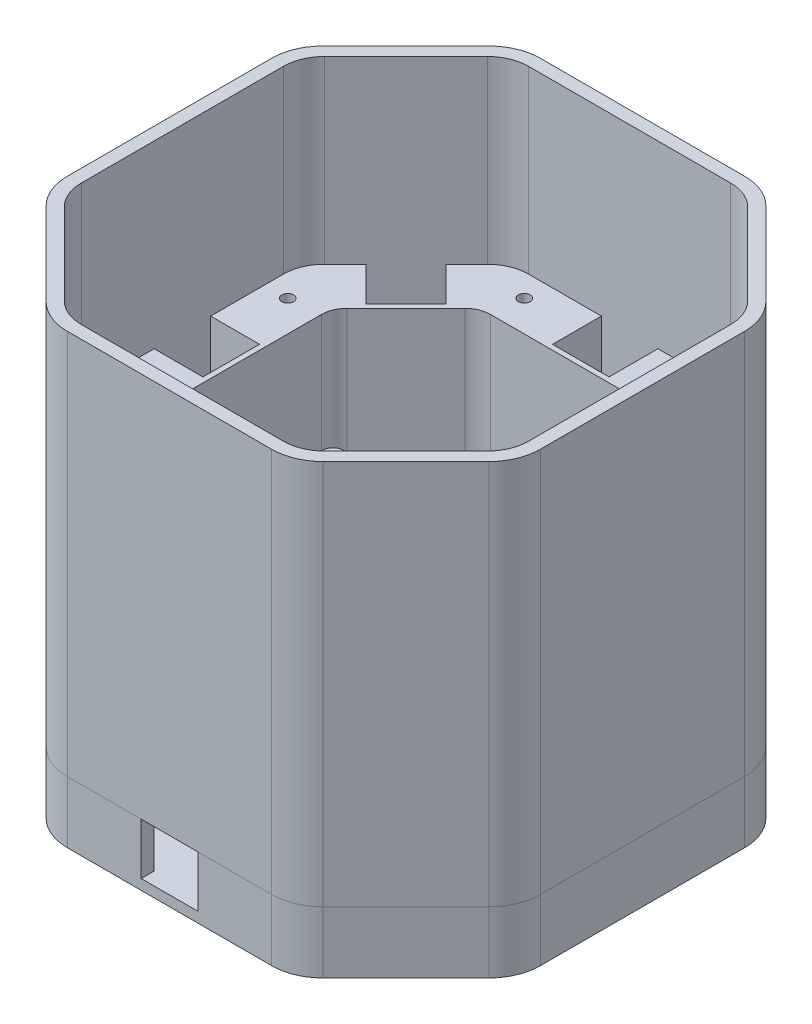
from build123d import *

# Parameters (mm, degrees)
EXTRUDE_1_DEPTH      = 35
SKETCH_2_W           = 14
SKETCH_2_H           = 10.5
EXTRUDE_2_DEPTH      = 30
EXTRUDE_2_2_DEPTH    = 30
SKETCH_2_W_2         = 10.5
SKETCH_2_H_2         = 14
EXTRUDE_2_3_DEPTH    = 30
EXTRUDE_2_4_DEPTH    = 30
EXTRUDE_2_5_DEPTH    = 30
EXTRUDE_2_6_DEPTH    = 30
EXTRUDE_2_7_DEPTH    = 30
EXTRUDE_2_8_DEPTH    = 30
EXTRUDE_3_DEPTH      = 40
EXTRUDE_4_DEPTH      = 10
SKETCH_7_W           = 20
SKETCH_7_H           = 11.5
EXTRUDE_5_DEPTH      = 30
SKETCH_8_W           = 11
SKETCH_8_H           = 9.5
SKETCH_8_W_2         = 9.5
SKETCH_8_H_2         = 11
CUT_EXTRUDE_1_DEPTH  = 77.367532368
CUT_EXTRUDE_2_DEPTH  = 8
FILLET_1_R           = 8
FILLET_2_R           = 10
EXTRUDE_START        = 30
EXTRUDE_7_DEPTH      = 30
FILLET_3_R           = 5
FILLET_4_R           = 5
FILLET_5_R           = 2
SKETCH_17_R          = 1.15
CUT_EXTRUDE_6_DEPTH  = 77.367532368
SKETCH_18_R          = 2
CUT_EXTRUDE_7_DEPTH  = 29
SKETCH_20_W          = 9.5
SKETCH_20_H          = 7
SKETCH_20_W_2        = 7
SKETCH_20_H_2        = 9.5
EXTRUDE_8_DEPTH      = 8
FILLET_6_R           = 3
SKETCH_21_R          = 1.65
CUT_EXTRUDE_8_DEPTH  = 10
EXTRUDE_9_DEPTH      = 12
CUT_EXTRUDE_10_DEPTH = 10
SKETCH_24_R          = 1.15
CUT_EXTRUDE_11_DEPTH = 109.632407688
SKETCH_25_R          = 2.05
CUT_EXTRUDE_12_DEPTH = 2
SKETCH_26_W          = 11
SKETCH_26_H          = 2.5
CUT_EXTRUDE_13_DEPTH = 10


# Read off the part's stored shape, not the designer's step: 凸台-拉伸1
with BuildPart() as part:
    # 凸台-拉伸1 outline → 凸台-拉伸1 (new body)
    with BuildSketch(Plane(origin=(0, 0, 0), x_dir=(1, 0, 0), z_dir=(0, 1, 0))):
        Polygon((24.003571337, -46), (46, -24.003571337), (46, 24.003571337), (24.003571337, 46), (-24.003571337, 46), (-46, 24.003571337), (-46, -24.003571337), (-24.003571337, -46), align=None)
        Polygon((43.5, 22.968037432), (43.5, -22.968037432), (22.968037432, -43.5), (-22.968037432, -43.5), (-43.5, -22.968037432), (-43.5, 22.968037432), (-22.968037432, 43.5), (22.968037432, 43.5), align=None, mode=Mode.SUBTRACT)
    extrude(amount=EXTRUDE_1_DEPTH)



with BuildPart() as body_2:
    # 草图2 → 凸台-拉伸2 (new body)
    with BuildSketch(Plane.XZ):
        with Locations((0, -38.25)):
            Rectangle(SKETCH_2_W, SKETCH_2_H)
    extrude(amount=EXTRUDE_2_DEPTH)


with BuildPart() as body_3:
    # 草图2 → Extrude 2 2 (new body)
    with BuildSketch(Plane.XZ):
        Polygon((20.859650045, -30.759144982), (28.284271247, -38.183766184), (38.183766184, -28.284271247), (30.759144982, -20.859650045), align=None)
    extrude(amount=EXTRUDE_2_2_DEPTH)


with BuildPart() as body_4:
    # 草图2 → Extrude 2 3 (new body)
    with BuildSketch(Plane.XZ):
        with Locations((-38.25, 0)):
            Rectangle(SKETCH_2_W_2, SKETCH_2_H_2)
    extrude(amount=EXTRUDE_2_3_DEPTH)


with BuildPart() as body_5:
    # 草图2 → Extrude 2 4 (new body)
    with BuildSketch(Plane.XZ):
        Polygon((-30.759144982, -20.859650045), (-20.859650045, -30.759144982), (-28.284271247, -38.183766184), (-38.183766184, -28.284271247), align=None)
    extrude(amount=EXTRUDE_2_4_DEPTH)


with BuildPart() as body_6:
    # 草图2 → Extrude 2 5 (new body)
    with BuildSketch(Plane.XZ):
        with Locations((0, 38.25)):
            Rectangle(SKETCH_2_W, SKETCH_2_H)
    extrude(amount=EXTRUDE_2_5_DEPTH)


with BuildPart() as body_7:
    # 草图2 → Extrude 2 6 (new body)
    with BuildSketch(Plane.XZ):
        Polygon((-20.859650045, 30.759144982), (-30.759144982, 20.859650045), (-38.183766184, 28.284271247), (-28.284271247, 38.183766184), align=None)
    extrude(amount=EXTRUDE_2_6_DEPTH)


with BuildPart() as body_8:
    # 草图2 → Extrude 2 7 (new body)
    with BuildSketch(Plane.XZ):
        with Locations((38.25, 0)):
            Rectangle(SKETCH_2_W_2, SKETCH_2_H_2)
    extrude(amount=EXTRUDE_2_7_DEPTH)


with BuildPart() as body_9:
    # 草图2 → Extrude 2 8 (new body)
    with BuildSketch(Plane.XZ):
        Polygon((30.759144982, 20.859650045), (20.859650045, 30.759144982), (28.284271247, 38.183766184), (38.183766184, 28.284271247), align=None)
    extrude(amount=EXTRUDE_2_8_DEPTH)


with BuildPart() as part_1:
    add(part.part)

    add(body_2.part)  # 凸台-拉伸3 merges body 2

    add(body_3.part)  # 凸台-拉伸3 merges body 3

    add(body_4.part)  # 凸台-拉伸3 merges body 4

    add(body_5.part)  # 凸台-拉伸3 merges body 5

    add(body_6.part)  # 凸台-拉伸3 merges body 6

    add(body_7.part)  # 凸台-拉伸3 merges body 7

    add(body_8.part)  # 凸台-拉伸3 merges body 8

    add(body_9.part)  # 凸台-拉伸3 merges body 9
    # 草图5 → 凸台-拉伸3 (add)
    with BuildSketch(Plane.XZ):
        Polygon((46, 24.003571337), (24.003571337, 46), (-24.003571337, 46), (-46, 24.003571337), (-46, -24.003571337), (-24.003571337, -46), (24.003571337, -46), (46, -24.003571337), align=None)
        Polygon((22.968037432, 43.5), (-22.968037432, 43.5), (-43.5, 22.968037432), (-43.5, -22.968037432), (-22.968037432, -43.5), (22.968037432, -43.5), (43.5, -22.968037432), (43.5, 22.968037432), align=None, mode=Mode.SUBTRACT)
    extrude(amount=EXTRUDE_3_DEPTH)

    # 草图6 → 凸台-拉伸4 (add)
    with BuildSketch(Plane.XZ.offset(30)):
        Polygon((46, -24.003571337), (46, 24.003571337), (24.003571337, 46), (-24.003571337, 46), (-46, 24.003571337), (-46, -24.003571337), (-24.003571337, -46), (24.003571337, -46), align=None)
    extrude(amount=EXTRUDE_4_DEPTH)

    # 草图7 → 凸台-拉伸5 (add)
    with BuildSketch(Plane(origin=(0, -30, 0), x_dir=(1, 0, 0), z_dir=(0, 1, 0))):
        with Locations((0, -9.95)):
            Rectangle(SKETCH_7_W, SKETCH_7_H)
    extrude(amount=EXTRUDE_5_DEPTH)

    # 草图8 → 切除-拉伸1 (cut, through all)
    with BuildSketch(Plane(origin=(0, 0, 0), x_dir=(1, 0, 0), z_dir=(0, 1, 0))):
        with Locations((0, -38.75)):
            Rectangle(SKETCH_8_W, SKETCH_8_H)
        Polygon((22.627416998, -30.405591591), (29.344931419, -37.123106012), (37.123106012, -29.344931419), (30.405591591, -22.627416998), align=None)
        with Locations((-38.75, 0)):
            Rectangle(SKETCH_8_W_2, SKETCH_8_H_2)
        Polygon((-30.405591591, -22.627416998), (-37.123106012, -29.344931419), (-29.344931419, -37.123106012), (-22.627416998, -30.405591591), align=None)
        with Locations((0, 38.75)):
            Rectangle(SKETCH_8_W, SKETCH_8_H)
        Polygon((-22.627416998, 30.405591591), (-29.344931419, 37.123106012), (-37.123106012, 29.344931419), (-30.405591591, 22.627416998), align=None)
        with Locations((38.75, 0)):
            Rectangle(SKETCH_8_W_2, SKETCH_8_H_2)
        Polygon((30.405591591, 22.627416998), (37.123106012, 29.344931419), (29.344931419, 37.123106012), (22.627416998, 30.405591591), align=None)
        with Locations((0, -9.95)):
            Rectangle(SKETCH_8_W, SKETCH_8_H)
    extrude(amount=-CUT_EXTRUDE_1_DEPTH, mode=Mode.SUBTRACT)

    # 草图9 → 切除-拉伸2 (cut)
    with BuildSketch(Plane.XZ.offset(40)):
        Polygon((43.5, -22.968037432), (43.5, 22.968037432), (22.968037432, 43.5), (-22.968037432, 43.5), (-43.5, 22.968037432), (-43.5, -22.968037432), (-22.968037432, -43.5), (22.968037432, -43.5), align=None)
    extrude(amount=-CUT_EXTRUDE_2_DEPTH, mode=Mode.SUBTRACT)

    # 圆角1
    fillet_1_edges = [part_1.edges().sort_by_distance(p)[0] for p in [
        (22.968037432, 17.5, 43.5),
        (43.5, 17.5, 22.968037432),
        (43.5, 17.5, -22.968037432),
        (22.968037432, 17.5, -43.5),
        (-22.968037432, 17.5, -43.5),
        (-43.5, 17.5, -22.968037432),
        (-43.5, 17.5, 22.968037432),
        (-22.968037432, 17.5, 43.5),
    ]]
    fillet(fillet_1_edges, radius=FILLET_1_R)

    # 圆角2
    fillet_2_edges = [part_1.edges().sort_by_distance(p)[0] for p in [
        (24.003571337, -2.5, 46),
        (-24.003571337, -20, 46),
        (-46, -20, 24.003571337),
        (-46, -20, -24.003571337),
        (-24.003571337, -20, -46),
        (24.003571337, -20, -46),
        (46, -20, -24.003571337),
        (46, -20, 24.003571337),
    ]]
    fillet(fillet_2_edges, radius=FILLET_2_R)

    # 草图15 → 凸台-拉伸7 (add)
    with BuildSketch(Plane(origin=(0, -30, 0), x_dir=(1, 0, 0), z_dir=(0, 1, 0)).offset(EXTRUDE_START)):
        with BuildLine():
            Line((-43.5, 7), (-33, 7))
            Line((-33, 7), (-33, 18.618795027))
            Line((-33, 18.618795027), (-30.759144982, 20.859650045))
            Line((-30.759144982, 20.859650045), (-38.183766184, 28.284271247))
            Line((-38.183766184, 28.284271247), (-41.156854249, 25.311183182))
            ThreePointArc((-41.156854249, 25.311183182), (-42.89103626, 22.715796391), (-43.5, 19.654328933))
            Line((-43.5, 19.654328933), (-43.5, 7))
        make_face()
        with BuildLine():
            Line((-28.284271247, 38.183766184), (-20.859650045, 30.759144982))
            Line((-20.859650045, 30.759144982), (-18.618795027, 33))
            Line((-18.618795027, 33), (-7, 33))
            Line((-7, 33), (-7, 43.5))
            Line((-7, 43.5), (-19.654328933, 43.5))
            ThreePointArc((-19.654328933, 43.5), (-22.715796391, 42.89103626), (-25.311183182, 41.156854249))
            Line((-25.311183182, 41.156854249), (-28.284271247, 38.183766184))
        make_face()
        with BuildLine():
            Line((7, 43.5), (7, 33))
            Line((7, 33), (18.618795027, 33))
            Line((18.618795027, 33), (20.859650045, 30.759144982))
            Line((20.859650045, 30.759144982), (28.284271247, 38.183766184))
            Line((28.284271247, 38.183766184), (25.311183182, 41.156854249))
            ThreePointArc((25.311183182, 41.156854249), (22.715796391, 42.89103626), (19.654328933, 43.5))
            Line((19.654328933, 43.5), (7, 43.5))
        make_face()
        with BuildLine():
            Line((38.183766184, 28.284271247), (30.759144982, 20.859650045))
            Line((30.759144982, 20.859650045), (33, 18.618795027))
            Line((33, 18.618795027), (33, 7))
            Line((33, 7), (43.5, 7))
            Line((43.5, 7), (43.5, 19.654328933))
            ThreePointArc((43.5, 19.654328933), (42.89103626, 22.715796391), (41.156854249, 25.311183182))
            Line((41.156854249, 25.311183182), (38.183766184, 28.284271247))
        make_face()
        with BuildLine():
            Line((33, -18.618795027), (30.759144982, -20.859650045))
            Line((30.759144982, -20.859650045), (38.183766184, -28.284271247))
            Line((38.183766184, -28.284271247), (41.156854249, -25.311183182))
            ThreePointArc((41.156854249, -25.311183182), (42.89103626, -22.715796391), (43.5, -19.654328933))
            Line((43.5, -19.654328933), (43.5, -7))
            Line((43.5, -7), (33, -7))
            Line((33, -7), (33, -18.618795027))
        make_face()
        with BuildLine():
            Line((18.618795027, -33), (7, -33))
            Line((7, -33), (7, -43.5))
            Line((7, -43.5), (19.654328933, -43.5))
            ThreePointArc((19.654328933, -43.5), (22.715796391, -42.89103626), (25.311183182, -41.156854249))
            Line((25.311183182, -41.156854249), (28.284271247, -38.183766184))
            Line((28.284271247, -38.183766184), (20.859650045, -30.759144982))
            Line((20.859650045, -30.759144982), (18.618795027, -33))
        make_face()
        with BuildLine():
            Line((-18.618795027, -33), (-20.859650045, -30.759144982))
            Line((-20.859650045, -30.759144982), (-28.284271247, -38.183766184))
            Line((-28.284271247, -38.183766184), (-25.311183182, -41.156854249))
            ThreePointArc((-25.311183182, -41.156854249), (-22.715796391, -42.89103626), (-19.654328933, -43.5))
            Line((-19.654328933, -43.5), (-7, -43.5))
            Line((-7, -43.5), (-7, -33))
            Line((-7, -33), (-18.618795027, -33))
        make_face()
        with BuildLine():
            Line((-33, -18.618795027), (-33, -7))
            Line((-33, -7), (-43.5, -7))
            Line((-43.5, -7), (-43.5, -19.654328933))
            ThreePointArc((-43.5, -19.654328933), (-42.89103626, -22.715796391), (-41.156854249, -25.311183182))
            Line((-41.156854249, -25.311183182), (-38.183766184, -28.284271247))
            Line((-38.183766184, -28.284271247), (-30.759144982, -20.859650045))
            Line((-30.759144982, -20.859650045), (-33, -18.618795027))
        make_face()
    extrude(amount=-EXTRUDE_7_DEPTH)

    # 圆角3
    fillet_3_edges = [part_1.edges().sort_by_distance(p)[0] for p in [
        (22.968037432, -36, 43.5),
        (43.5, -36, 22.968037432),
        (-43.5, -36, 22.968037432),
        (-22.968037432, -36, 43.5),
        (-22.968037432, -36, -43.5),
        (43.5, -36, -22.968037432),
        (-43.5, -36, -22.968037432),
        (22.968037432, -36, -43.5),
    ]]
    fillet(fillet_3_edges, radius=FILLET_3_R)

    # 圆角4
    fillet_4_edges = [part_1.edges().sort_by_distance(p)[0] for p in [
        (-33, -15, -18.618795027),
        (-18.618795027, -15, -33),
        (18.618795027, -15, -33),
        (33, -15, -18.618795027),
        (33, -15, 18.618795027),
        (18.618795027, -15, 33),
        (-18.618795027, -15, 33),
        (-33, -15, 18.618795027),
    ]]
    fillet(fillet_4_edges, radius=FILLET_4_R)

    # 圆角5
    fillet_5_edges = [part_1.edges().sort_by_distance(p)[0] for p in [
        (10, -15, 15.7),
        (10, -15, 4.2),
        (-10, -15, 4.2),
        (-10, -15, 15.7),
    ]]
    fillet(fillet_5_edges, radius=FILLET_5_R)

    # 草图17 → 切除-拉伸6 (cut, through all)
    with BuildSketch(Plane(origin=(0, 0, 0), x_dir=(1, 0, 0), z_dir=(0, 1, 0))):
        with Locations(Location((-16, -39, 0), (0, 0, 270))):
            Circle(SKETCH_17_R)
        with Locations(Location((16, -39, 0), (0, 0, 270))):
            Circle(SKETCH_17_R)
        with Locations(Location((-39, 16, 0), (0, 0, 270))):
            Circle(SKETCH_17_R)
        with Locations(Location((-39, -16, 0), (0, 0, 270))):
            Circle(SKETCH_17_R)
        with Locations(Location((16, 39, 0), (0, 0, 270))):
            Circle(SKETCH_17_R)
        with Locations(Location((-16, 39, 0), (0, 0, 270))):
            Circle(SKETCH_17_R)
        with Locations(Location((39, -16, 0), (0, 0, 270))):
            Circle(SKETCH_17_R)
        with Locations(Location((39, 16, 0), (0, 0, 270))):
            Circle(SKETCH_17_R)
    extrude(amount=-CUT_EXTRUDE_6_DEPTH, mode=Mode.SUBTRACT)

    # 草图18 → 切除-拉伸7 (cut)
    with BuildSketch(Plane.XZ.offset(32)):
        with Locations(Location((-16, 39, 0), (0, 0, 270))):
            Circle(SKETCH_18_R)
        with Locations(Location((16, 39, 0), (0, 0, 270))):
            Circle(SKETCH_18_R)
        with Locations(Location((39, 16, 0), (0, 0, 270))):
            Circle(SKETCH_18_R)
        with Locations(Location((39, -16, 0), (0, 0, 270))):
            Circle(SKETCH_18_R)
        with Locations(Location((16, -39, 0), (0, 0, 270))):
            Circle(SKETCH_18_R)
        with Locations(Location((-16, -39, 0), (0, 0, 270))):
            Circle(SKETCH_18_R)
        with Locations(Location((-39, -16, 0), (0, 0, 270))):
            Circle(SKETCH_18_R)
        with Locations(Location((-39, 16, 0), (0, 0, 270))):
            Circle(SKETCH_18_R)
    extrude(amount=-CUT_EXTRUDE_7_DEPTH, mode=Mode.SUBTRACT)

    # 草图20 → 凸台-拉伸8 (add)
    with BuildSketch(Plane.XZ.offset(32)):
        with Locations((-38.75, 9)):
            Rectangle(SKETCH_20_W, SKETCH_20_H)
        with Locations((9, 38.75)):
            Rectangle(SKETCH_20_W_2, SKETCH_20_H_2)
        with Locations((38.75, -9)):
            Rectangle(SKETCH_20_W, SKETCH_20_H)
        with Locations((-9, -38.75)):
            Rectangle(SKETCH_20_W_2, SKETCH_20_H_2)
    extrude(amount=EXTRUDE_8_DEPTH)

    # 圆角6
    fillet_6_edges = [part_1.edges().sort_by_distance(p)[0] for p in [
        (-34, -36, 5.5),
        (-34, -36, 12.5),
        (5.5, -36, 34),
        (12.5, -36, 34),
        (34, -36, -5.5),
        (34, -36, -12.5),
        (-5.5, -36, -34),
        (-12.5, -36, -34),
    ]]
    fillet(fillet_6_edges, radius=FILLET_6_R)

    # 草图21 → 切除-拉伸8 (cut)
    with BuildSketch(Plane.XZ.offset(40)):
        with Locations(Location((-37.5, 9, 0), (0, 0, 270))):
            Circle(SKETCH_21_R)
        with Locations(Location((9, 37.5, 0), (0, 0, 270))):
            Circle(SKETCH_21_R)
        with Locations(Location((37.5, -9, 0), (0, 0, 270))):
            Circle(SKETCH_21_R)
        with Locations(Location((-9, -37.5, 0), (0, 0, 270))):
            Circle(SKETCH_21_R)
    extrude(amount=-CUT_EXTRUDE_8_DEPTH, mode=Mode.SUBTRACT)


with BuildPart() as body_2_2:
    # 草图22 → 凸台-拉伸9 (new body)
    with BuildSketch(Plane.XZ.offset(40)):
        with BuildLine():
            Line((43.071067812, 26.932503526), (26.932503526, 43.071067812))
            ThreePointArc((26.932503526, 43.071067812), (23.688270037, 45.238795325), (19.861435714, 46))
            Line((19.861435714, 46), (-19.861435714, 46))
            ThreePointArc((-19.861435714, 46), (-23.688270037, 45.238795325), (-26.932503526, 43.071067812))
            Line((-26.932503526, 43.071067812), (-43.071067812, 26.932503526))
            ThreePointArc((-43.071067812, 26.932503526), (-45.238795325, 23.688270037), (-46, 19.861435714))
            Line((-46, 19.861435714), (-46, -19.861435714))
            ThreePointArc((-46, -19.861435714), (-45.238795325, -23.688270037), (-43.071067812, -26.932503526))
            Line((-43.071067812, -26.932503526), (-26.932503526, -43.071067812))
            ThreePointArc((-26.932503526, -43.071067812), (-23.688270037, -45.238795325), (-19.861435714, -46))
            Line((-19.861435714, -46), (19.861435714, -46))
            ThreePointArc((19.861435714, -46), (23.688270037, -45.238795325), (26.932503526, -43.071067812))
            Line((26.932503526, -43.071067812), (43.071067812, -26.932503526))
            ThreePointArc((43.071067812, -26.932503526), (45.238795325, -23.688270037), (46, -19.861435714))
            Line((46, -19.861435714), (46, 19.861435714))
            ThreePointArc((46, 19.861435714), (45.238795325, 23.688270037), (43.071067812, 26.932503526))
        make_face()
    extrude(amount=EXTRUDE_9_DEPTH)

    # 草图23 → 切除-拉伸10 (cut)
    with BuildSketch(Plane(origin=(0, -40, 0), x_dir=(1, 0, 0), z_dir=(0, 1, 0))):
        with BuildLine():
            Line((-8.5, 34), (-9.5, 34))
            ThreePointArc((-9.5, 34), (-11.621320344, 34.878679656), (-12.5, 37))
            Line((-12.5, 37), (-12.5, 43.5))
            Line((-12.5, 43.5), (-20.89696962, 43.5))
            ThreePointArc((-20.89696962, 43.5), (-22.810386781, 43.119397663), (-24.432503526, 42.035533906))
            Line((-24.432503526, 42.035533906), (-42.035533906, 24.432503526))
            ThreePointArc((-42.035533906, 24.432503526), (-43.119397663, 22.810386781), (-43.5, 20.89696962))
            Line((-43.5, 20.89696962), (-43.5, -5.5))
            Line((-43.5, -5.5), (-37, -5.5))
            ThreePointArc((-37, -5.5), (-34.878679656, -6.378679656), (-34, -8.5))
            Line((-34, -8.5), (-34, -9.5))
            ThreePointArc((-34, -9.5), (-34.878679656, -11.621320344), (-37, -12.5))
            Line((-37, -12.5), (-43.5, -12.5))
            Line((-43.5, -12.5), (-43.5, -20.89696962))
            ThreePointArc((-43.5, -20.89696962), (-43.119397663, -22.810386781), (-42.035533906, -24.432503526))
            Line((-42.035533906, -24.432503526), (-24.432503526, -42.035533906))
            ThreePointArc((-24.432503526, -42.035533906), (-22.810386781, -43.119397663), (-20.89696962, -43.5))
            Line((-20.89696962, -43.5), (5.5, -43.5))
            Line((5.5, -43.5), (5.5, -37))
            ThreePointArc((5.5, -37), (6.378679656, -34.878679656), (8.5, -34))
            Line((8.5, -34), (9.5, -34))
            ThreePointArc((9.5, -34), (11.621320344, -34.878679656), (12.5, -37))
            Line((12.5, -37), (12.5, -43.5))
            Line((12.5, -43.5), (20.89696962, -43.5))
            ThreePointArc((20.89696962, -43.5), (22.810386781, -43.119397663), (24.432503526, -42.035533906))
            Line((24.432503526, -42.035533906), (42.035533906, -24.432503526))
            ThreePointArc((42.035533906, -24.432503526), (43.119397663, -22.810386781), (43.5, -20.89696962))
            Line((43.5, -20.89696962), (43.5, 5.5))
            Line((43.5, 5.5), (37, 5.5))
            ThreePointArc((37, 5.5), (34.878679656, 6.378679656), (34, 8.5))
            Line((34, 8.5), (34, 9.5))
            ThreePointArc((34, 9.5), (34.878679656, 11.621320344), (37, 12.5))
            Line((37, 12.5), (43.5, 12.5))
            Line((43.5, 12.5), (43.5, 20.89696962))
            ThreePointArc((43.5, 20.89696962), (43.119397663, 22.810386781), (42.035533906, 24.432503526))
            Line((42.035533906, 24.432503526), (24.432503526, 42.035533906))
            ThreePointArc((24.432503526, 42.035533906), (22.810386781, 43.119397663), (20.89696962, 43.5))
            Line((20.89696962, 43.5), (-5.5, 43.5))
            Line((-5.5, 43.5), (-5.5, 37))
            ThreePointArc((-5.5, 37), (-6.378679656, 34.878679656), (-8.5, 34))
        make_face()
    extrude(amount=-CUT_EXTRUDE_10_DEPTH, mode=Mode.SUBTRACT)

    # 草图24 → 切除-拉伸11 (cut, through all)
    with BuildSketch(Plane.XZ.offset(52)):
        with Locations(Location((9, 37.5, 0), (0, 0, 270))):
            Circle(SKETCH_24_R)
        with Locations(Location((37.5, -9, 0), (0, 0, 270))):
            Circle(SKETCH_24_R)
        with Locations(Location((-9, -37.5, 0), (0, 0, 270))):
            Circle(SKETCH_24_R)
        with Locations(Location((-37.5, 9, 0), (0, 0, 270))):
            Circle(SKETCH_24_R)
    extrude(amount=-CUT_EXTRUDE_11_DEPTH, mode=Mode.SUBTRACT)

    # 草图25 → 切除-拉伸12 (cut)
    with BuildSketch(Plane.XZ.offset(52)):
        with Locations(Location((9, 37.5, 0), (0, 0, 270))):
            Circle(SKETCH_25_R)
        with Locations(Location((37.5, -9, 0), (0, 0, 270))):
            Circle(SKETCH_25_R)
        with Locations(Location((-37.5, 9, 0), (0, 0, 270))):
            Circle(SKETCH_25_R)
        with Locations(Location((-9, -37.5, 0), (0, 0, 270))):
            Circle(SKETCH_25_R)
    extrude(amount=-CUT_EXTRUDE_12_DEPTH, mode=Mode.SUBTRACT)

    # 草图26 → 切除-拉伸13 (cut)
    with BuildSketch(Plane(origin=(0, -40, 0), x_dir=(1, 0, 0), z_dir=(0, 1, 0))):
        with Locations((0, -44.75)):
            Rectangle(SKETCH_26_W, SKETCH_26_H)
    extrude(amount=-CUT_EXTRUDE_13_DEPTH, mode=Mode.SUBTRACT)


solid = Compound([part_1.part, body_2_2.part])
